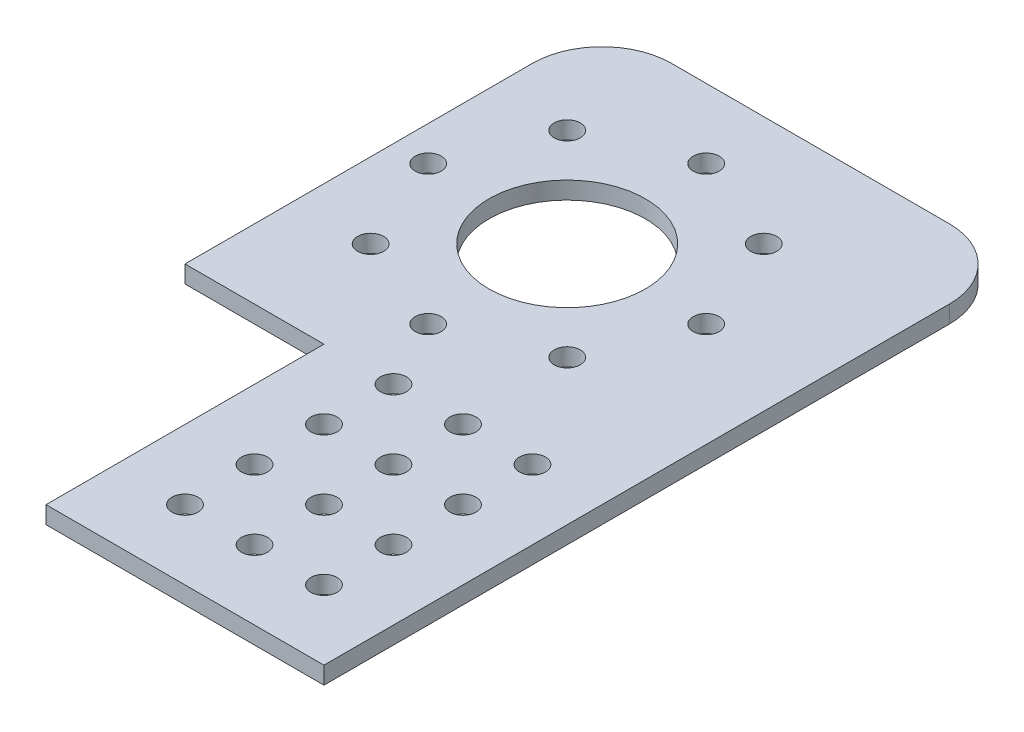
from build123d import *

# Parameters (mm, degrees)
SKETCH1_R           = 2.38125
SKETCH1_R_2         = 14.2875
BOSS_EXTRUDE1_DEPTH = 3.175
FILLET1_R           = 12.7
SKETCH2_R           = 2.38125
CUT_EXTRUDE1_DEPTH  = 137.820030058


with BuildPart() as part:
    # Sketch1 → Boss-Extrude1 (new body)
    with BuildSketch(Plane(origin=(0, 0, 0), x_dir=(1, 0, 0), z_dir=(0, 1, 0))):
        Polygon((0, 0), (50.8, 0), (50.8, 127), (-25.4, 127), (-25.4, 50.8), (0, 50.8), align=None)
        with Locations((12.7, 12.7)):
            Circle(SKETCH1_R, mode=Mode.SUBTRACT)
        with Locations((25.4, 12.7)):
            Circle(SKETCH1_R, mode=Mode.SUBTRACT)
        with Locations((38.1, 12.7)):
            Circle(SKETCH1_R, mode=Mode.SUBTRACT)
        with Locations((25.4, 25.4)):
            Circle(SKETCH1_R, mode=Mode.SUBTRACT)
        with Locations((38.1, 25.4)):
            Circle(SKETCH1_R, mode=Mode.SUBTRACT)
        with Locations((25.4, 38.1)):
            Circle(SKETCH1_R, mode=Mode.SUBTRACT)
        with Locations((38.1, 38.1)):
            Circle(SKETCH1_R, mode=Mode.SUBTRACT)
        with Locations((12.7, 25.4)):
            Circle(SKETCH1_R, mode=Mode.SUBTRACT)
        with Locations((12.7, 38.1)):
            Circle(SKETCH1_R, mode=Mode.SUBTRACT)
        with Locations((6.35, 88.9)):
            Circle(SKETCH1_R_2, mode=Mode.SUBTRACT)
        with Locations((12.7, 50.8)):
            Circle(SKETCH1_R, mode=Mode.SUBTRACT)
        with Locations((25.4, 50.8)):
            Circle(SKETCH1_R, mode=Mode.SUBTRACT)
        with Locations((38.1, 50.8)):
            Circle(SKETCH1_R, mode=Mode.SUBTRACT)
    extrude(amount=BOSS_EXTRUDE1_DEPTH)

    # Fillet1
    fillet1_edges = [part.edges().sort_by_distance(p)[0] for p in [
        (-25.4, 1.5875, -127),
        (50.8, 1.5875, -127),
    ]]
    fillet(fillet1_edges, radius=FILLET1_R)

    # Sketch2 → Cut-Extrude1 (cut, through all)
    with BuildSketch(Plane(origin=(0, 3.175, 0), x_dir=(1, 0, 0), z_dir=(0, 1, 0))):
        with Locations((-19.05, 88.9)):
            Circle(SKETCH2_R)
        with Locations((-11.610512242, 106.860512242)):
            Circle(SKETCH2_R)
        with Locations((6.35, 114.3)):
            Circle(SKETCH2_R)
        with Locations((24.310512242, 106.860512242)):
            Circle(SKETCH2_R)
        with Locations((31.75, 88.9)):
            Circle(SKETCH2_R)
        with Locations((24.310512242, 70.939487758)):
            Circle(SKETCH2_R)
        with Locations((6.35, 63.5)):
            Circle(SKETCH2_R)
        with Locations((-11.610512242, 70.939487758)):
            Circle(SKETCH2_R)
    extrude(amount=-CUT_EXTRUDE1_DEPTH, mode=Mode.SUBTRACT)


solid = part.part
